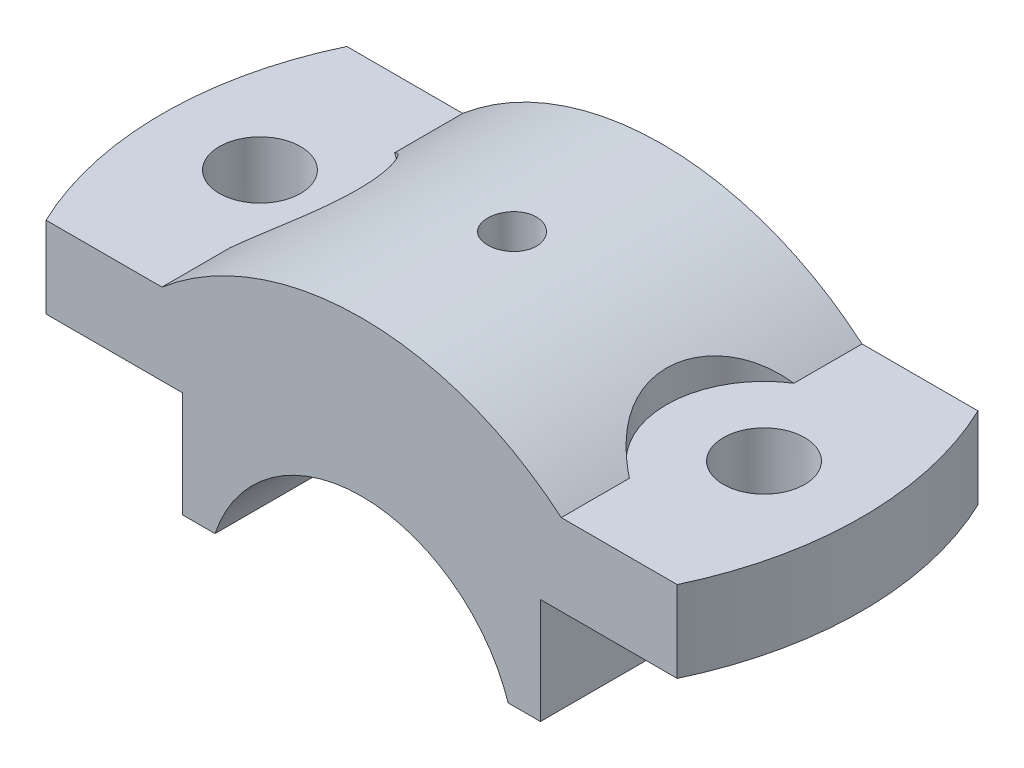
from build123d import *

# Parameters (mm, degrees)
BOSS_EXTRUDE1_DEPTH     = 18.5
CUT_EXTRUDE3_START      = -10
CUT_EXTRUDE3_DEPTH      = 10
SKETCH4_R               = 5
CUT_EXTRUDE4_DEPTH      = 53.156015952
SKETCH5_R               = 12
CUT_EXTRUDE5_DEPTH      = 37
SKETCH6_R               = 3
CUT_EXTRUDE6_DEPTH      = 13
CUT_EXTRUDE7_REACH      = 52.52
CUT_EXTRUDE7_END_RADIUS = 19
SKETCH7_R               = 2


# Read off the part's stored shape, not the designer's step: Cut-Extrude3
with BuildPart() as part:
    # Sketch2 → Boss-Extrude1 (new, symmetric)
    with BuildSketch(Plane.XY):
        with BuildLine():
            Line((-18.027756377, 6), (-22, 6))
            Line((-22, 6), (-22, 19))
            Line((-22, 19), (-43, 19))
            Line((-43, 19), (-43, 29))
            Line((-43, 29), (-24.556058316, 29))
            ThreePointArc((-24.556058316, 29), (0, 38), (24.556058316, 29))
            Line((24.556058316, 29), (43, 29))
            Line((43, 29), (43, 19))
            Line((43, 19), (22, 19))
            Line((22, 19), (22, 6))
            Line((22, 6), (18.027756377, 6))
            ThreePointArc((18.027756377, 6), (0, 19), (-18.027756377, 6))
        make_face()
    extrude(amount=BOSS_EXTRUDE1_DEPTH, both=True)

    # Cut-Extrude3 outline → Cut-Extrude3 (cut)
    with BuildSketch(Plane(origin=(0, 29, 0), x_dir=(1, 0, 0), z_dir=(0, 1, 0)).offset(CUT_EXTRUDE3_START)):
        with BuildLine():
            ThreePointArc((43, 0), (41.941183485, -9.483518751), (38.816877772, -18.5))
            Line((38.816877772, -18.5), (43, -18.5))
            Line((43, -18.5), (43, 0))
        make_face()
        with BuildLine():
            ThreePointArc((38.816877772, 18.5), (41.941183485, 9.483518751), (43, 0))
            Line((43, 0), (43, 18.5))
            Line((43, 18.5), (38.816877772, 18.5))
        make_face()
        with BuildLine():
            Line((-43, -18.5), (-38.816877772, -18.5))
            ThreePointArc((-38.816877772, -18.5), (-41.941183485, -9.483518751), (-43, 0))
            Line((-43, 0), (-43, -18.5))
        make_face()
        with BuildLine():
            Line((-43, 18.5), (-43, 0))
            ThreePointArc((-43, 0), (-41.941183485, 9.483518751), (-38.816877772, 18.5))
            Line((-38.816877772, 18.5), (-43, 18.5))
        make_face()
    extrude(amount=CUT_EXTRUDE3_DEPTH, mode=Mode.SUBTRACT)

    # Sketch4 → Cut-Extrude4 (cut, through all)
    with BuildSketch(Plane(origin=(0, 29, 0), x_dir=(1, 0, 0), z_dir=(0, 1, 0))):
        with Locations(Location((-31, 0, 0), (0, 0, 270))):
            Circle(SKETCH4_R)
        with Locations(Location((31, 0, 0), (0, 0, 180))):
            Circle(SKETCH4_R)
    extrude(amount=-CUT_EXTRUDE4_DEPTH, mode=Mode.SUBTRACT)

    # Sketch5 → Cut-Extrude5 (cut)
    with BuildSketch(Plane(origin=(0, 29, 0), x_dir=(1, 0, 0), z_dir=(0, 1, 0))):
        with Locations((-31, 0)):
            Circle(SKETCH5_R)
        with Locations((31, 0)):
            Circle(SKETCH5_R)
    extrude(amount=CUT_EXTRUDE5_DEPTH, mode=Mode.SUBTRACT)

    # Sketch6 → Cut-Extrude6 (cut)
    with BuildSketch(Plane(origin=(0, 38, 0), x_dir=(1, 0, 0), z_dir=(0, 1, 0))):
        with Locations(Location((0, 0, 0), (0, 0, 270))):
            Circle(SKETCH6_R)
    extrude(amount=-CUT_EXTRUDE6_DEPTH, mode=Mode.SUBTRACT)

    # Cut-Extrude7: up to this cylinder (the profile starts outside it)
    cut_extrude7_end = Plane(origin=(0, 0, 0), z_dir=(0, 0, -1)) * Cylinder(CUT_EXTRUDE7_END_RADIUS, 144.04, mode=Mode.PRIVATE)
    # Sketch7 → Cut-Extrude7 (cut, up to the surface)
    with BuildSketch(Plane(origin=(0, 25, 0), x_dir=(1, 0, 0), z_dir=(0, 1, 0)), mode=Mode.PRIVATE) as cut_extrude7_sk1:
        with Locations(Location((0, 0, 0), (0, 0, 270))):
            Circle(SKETCH7_R)
    cut_extrude7_tool1 = extrude(cut_extrude7_sk1.sketch, amount=-CUT_EXTRUDE7_REACH, mode=Mode.PRIVATE) - cut_extrude7_end
    add(cut_extrude7_tool1.solids().sort_by_distance((0, 25, 0))[0], mode=Mode.SUBTRACT)


solid = part.part
